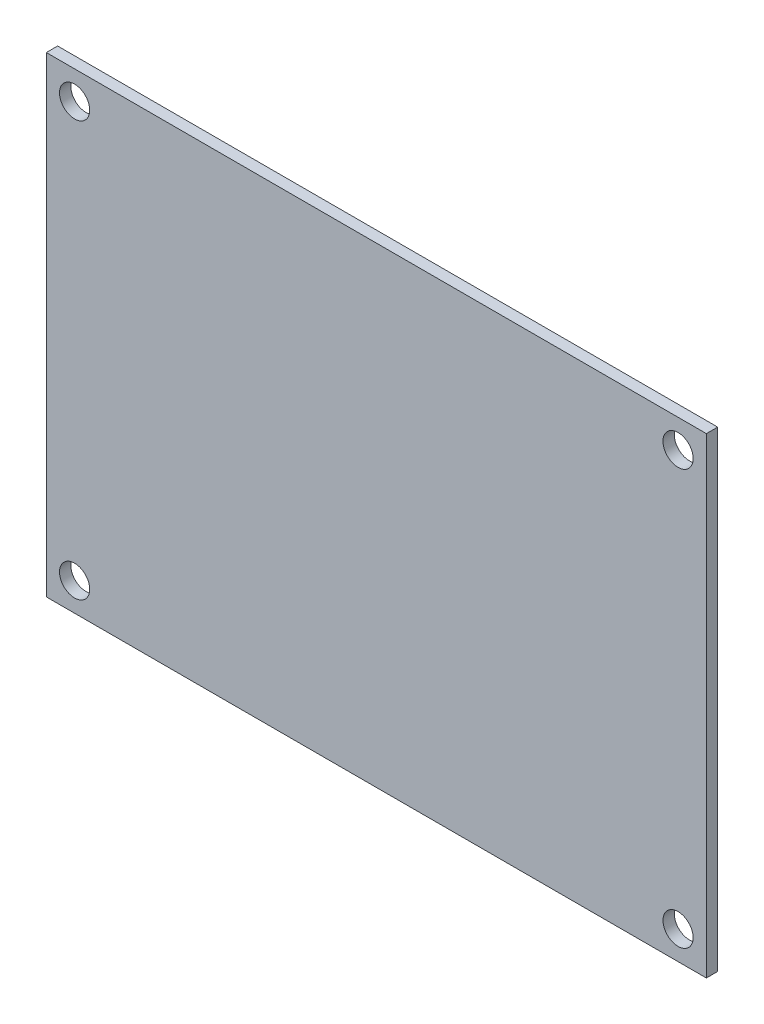
from build123d import *

# Parameters (mm, degrees)
SKETCH1_W           = 70
SKETCH1_H           = 50
BOSS_EXTRUDE1_DEPTH = 1.2
CUT_EXTRUDE1_REACH  = 45.028
SKETCH6_R           = 1.6


with BuildPart() as part:
    # Sketch1 → Boss-Extrude1 (new body)
    with BuildSketch(Plane.XY):
        Rectangle(SKETCH1_W, SKETCH1_H)
    extrude(amount=BOSS_EXTRUDE1_DEPTH)

    # Sketch6 → Cut-Extrude1 (cut, up to next)
    with BuildSketch(Plane.XY.offset(1.2), mode=Mode.PRIVATE) as cut_extrude1_sk1:
        with Locations((-32, -22)):
            Circle(SKETCH6_R)
    cut_extrude1_tool1 = extrude(cut_extrude1_sk1.sketch, amount=-CUT_EXTRUDE1_REACH, mode=Mode.PRIVATE) & part.part
    # Sketch6 → Cut-Extrude1 (cut, up to next)
    with BuildSketch(Plane.XY.offset(1.2), mode=Mode.PRIVATE) as cut_extrude1_sk2:
        with Locations((32, -22)):
            Circle(SKETCH6_R)
    cut_extrude1_tool2 = extrude(cut_extrude1_sk2.sketch, amount=-CUT_EXTRUDE1_REACH, mode=Mode.PRIVATE) & part.part
    # Sketch6 → Cut-Extrude1 (cut, up to next)
    with BuildSketch(Plane.XY.offset(1.2), mode=Mode.PRIVATE) as cut_extrude1_sk3:
        with Locations((32, 22)):
            Circle(SKETCH6_R)
    cut_extrude1_tool3 = extrude(cut_extrude1_sk3.sketch, amount=-CUT_EXTRUDE1_REACH, mode=Mode.PRIVATE) & part.part
    # Sketch6 → Cut-Extrude1 (cut, up to next)
    with BuildSketch(Plane.XY.offset(1.2), mode=Mode.PRIVATE) as cut_extrude1_sk4:
        with Locations((-32, 22)):
            Circle(SKETCH6_R)
    cut_extrude1_tool4 = extrude(cut_extrude1_sk4.sketch, amount=-CUT_EXTRUDE1_REACH, mode=Mode.PRIVATE) & part.part
    add(cut_extrude1_tool1.solids().sort_by_distance((-32, -22, 1.2))[0], mode=Mode.SUBTRACT)
    add(cut_extrude1_tool2.solids().sort_by_distance((32, -22, 1.2))[0], mode=Mode.SUBTRACT)
    add(cut_extrude1_tool3.solids().sort_by_distance((32, 22, 1.2))[0], mode=Mode.SUBTRACT)
    add(cut_extrude1_tool4.solids().sort_by_distance((-32, 22, 1.2))[0], mode=Mode.SUBTRACT)


solid = part.part
